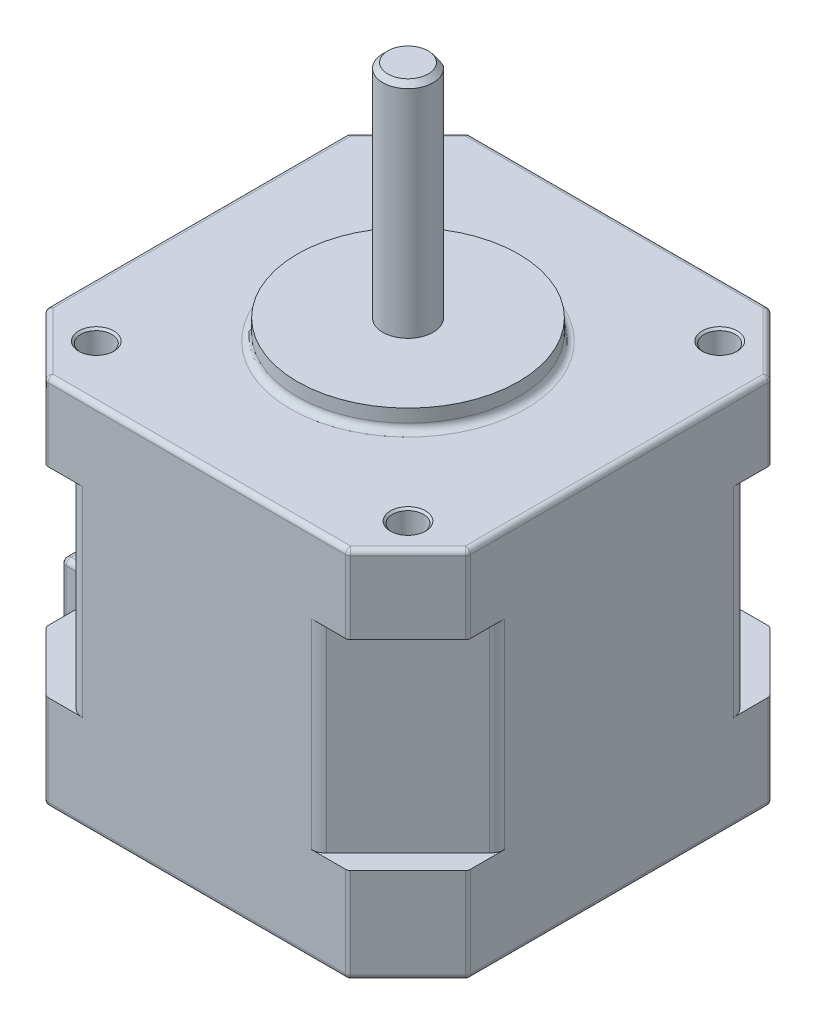
from build123d import *

# Parameters (mm, degrees)
SKETCH1_R           = 4.5
BOSS_EXTRUDE1_DEPTH = 9.5
BOSS_EXTRUDE2_DEPTH = 19.88
BOSS_EXTRUDE3_DEPTH = 7.72
SKETCH5_R           = 1.55
CUT_EXTRUDE1_DEPTH  = 7.5
SKETCH6_R           = 11
BOSS_EXTRUDE4_DEPTH = 2
BOSS_EXTRUDE5_DEPTH = 22
CHAMFER1_SIZE       = 0.2
FILLET1_R           = 0.5
FILLET2_R           = 0.7
CHAMFER2_SIZE       = 0.5
FILLET3_R           = 1.5


with BuildPart() as part:
    # Sketch1 → Boss-Extrude1 (new body)
    with BuildSketch(Plane(origin=(0, 0, 0), x_dir=(1, 0, 0), z_dir=(0, 1, 0))):
        Polygon((-42, 36), (-36, 42), (-6, 42), (0, 36), (0, 6), (-6, 0), (-36, 0), (-42, 6), (-42, 12.75), (-47.25, 12.75), (-47.25, 29.25), (-42, 29.25), align=None)
        with Locations(Location((-21, 21, 0), (0, 0, 270))):
            Circle(SKETCH1_R, mode=Mode.SUBTRACT)
    extrude(amount=BOSS_EXTRUDE1_DEPTH)

    # Sketch2 → Boss-Extrude2 (add)
    with BuildSketch(Plane(origin=(0, 9.5, 0), x_dir=(1, 0, 0), z_dir=(0, 1, 0))):
        Polygon((-33, 42), (-9, 42), (0, 33), (0, 9), (-9, 0), (-33, 0), (-42, 9), (-42, 33), align=None)
    extrude(amount=BOSS_EXTRUDE2_DEPTH)

    # Sketch3 → Boss-Extrude3 (add)
    with BuildSketch(Plane(origin=(0, 29.38, 0), x_dir=(1, 0, 0), z_dir=(0, 1, 0))):
        Polygon((-42, 6), (-42, 36), (-36, 42), (-6, 42), (0, 36), (0, 6), (-6, 0), (-36, 0), align=None)
    extrude(amount=BOSS_EXTRUDE3_DEPTH)

    # Sketch5 → Cut-Extrude1 (cut)
    with BuildSketch(Plane(origin=(0, 37.1, 0), x_dir=(1, 0, 0), z_dir=(0, 1, 0))):
        with Locations(Location((-36.5, 5.5, 0), (0, 0, 270))):
            Circle(SKETCH5_R)
        with Locations(Location((-5.5, 36.5, 0), (0, 0, 270))):
            Circle(SKETCH5_R)
        with Locations(Location((-36.5, 36.5, 0), (0, 0, 270))):
            Circle(SKETCH5_R)
        with Locations(Location((-5.5, 5.5, 0), (0, 0, 270))):
            Circle(SKETCH5_R)
    extrude(amount=-CUT_EXTRUDE1_DEPTH, mode=Mode.SUBTRACT)

    # Sketch6 → Boss-Extrude4 (add)
    with BuildSketch(Plane(origin=(0, 37.1, 0), x_dir=(1, 0, 0), z_dir=(0, 1, 0))):
        with Locations(Location((-21, 21, 0), (0, 0, 270))):
            Circle(SKETCH6_R)
    extrude(amount=BOSS_EXTRUDE4_DEPTH)

    # Sketch7 → Boss-Extrude5 (add)
    with BuildSketch(Plane(origin=(0, 39.1, 0), x_dir=(1, 0, 0), z_dir=(0, 1, 0))):
        with BuildLine():
            Line((-22.5, 23), (-19.5, 23))
            ThreePointArc((-19.5, 23), (-21, 18.5), (-22.5, 23))
        make_face()
    extrude(amount=BOSS_EXTRUDE5_DEPTH)

    # Chamfer1
    chamfer1_edges = [part.edges().sort_by_distance(p)[0] for p in [
        (-5.5, 37.1, -38.05),
        (-36.5, 37.1, -7.05),
        (-5.5, 37.1, -7.05),
        (-36.5, 37.1, -38.05),
    ]]
    chamfer(chamfer1_edges, length=CHAMFER1_SIZE)

    # Fillet1
    fillet1_edges = [part.edges().sort_by_distance(p)[0] for p in [
        (-42, 4.75, -12.75),
        (-42, 4.75, -29.25),
        (-44.625, 9.5, -12.75),
        (-44.625, 9.5, -29.25),
        (-42, 9.5, -21),
        (-47.25, 4.75, -29.25),
        (-47.25, 9.5, -21),
        (-47.25, 4.75, -12.75),
        (-21, 0, -25.5),
        (-44.625, 0, -29.25),
        (-47.25, 0, -21),
        (-44.625, 0, -12.75),
        (-42, 0, -9.375),
        (-39, 0, -3),
        (-21, 0, 0),
        (-3, 0, -3),
        (0, 0, -21),
        (-3, 0, -39),
        (-21, 0, -42),
        (-39, 0, -39),
        (-42, 0, -32.625),
        (-6, 4.75, -42),
        (0, 4.75, -36),
        (-42, 4.75, -36),
        (-36, 4.75, -42),
        (0, 4.75, -6),
        (-6, 4.75, 0),
        (-36, 4.75, 0),
        (-42, 4.75, -6),
        (-42, 33.24, -36),
        (-39, 37.1, -39),
        (-36, 33.24, -42),
        (-21, 37.1, -42),
        (-6, 33.24, -42),
        (0, 33.24, -36),
        (0, 37.1, -21),
        (-3, 37.1, -39),
        (0, 33.24, -6),
        (-6, 33.24, 0),
        (-42, 33.24, -6),
        (-36, 33.24, 0),
        (-3, 37.1, -3),
        (-21, 37.1, 0),
        (-39, 37.1, -3),
        (-42, 37.1, -21),
    ]]
    fillet(fillet1_edges, radius=FILLET1_R)

    # Fillet2
    fillet2_edges = [part.edges().sort_by_distance(p)[0] for p in [
        (-21, 37.1, -32),
    ]]
    fillet(fillet2_edges, radius=FILLET2_R)

    # Chamfer2
    chamfer2_edges = [part.edges().sort_by_distance(p)[0] for p in [
        (-21, 61.1, -18.5),
    ]]
    chamfer(chamfer2_edges, length=CHAMFER2_SIZE - 0.0001)  # a hair under: the kernel refuses the full size

    # Fillet3
    fillet3_edges = [part.edges().sort_by_distance(p)[0] for p in [
        (-33, 19.44, -42),
        (-42, 19.44, -33),
        (-42, 19.44, -9),
        (-33, 19.44, 0),
        (-9, 19.44, 0),
        (0, 19.44, -9),
        (0, 19.44, -33),
        (-9, 19.44, -42),
    ]]
    fillet(fillet3_edges, radius=FILLET3_R)


solid = part.part
